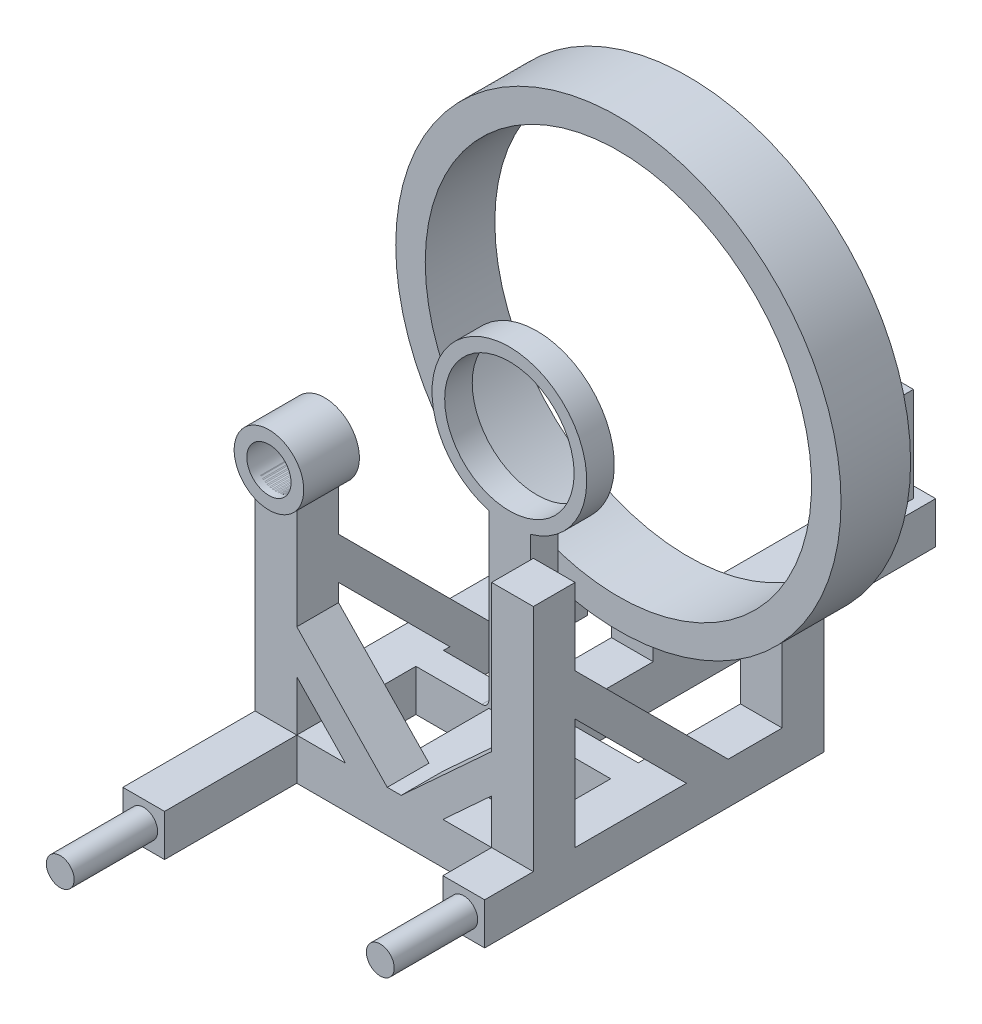
from build123d import *

# Parameters (mm, degrees)
SKETCH3_W            = 3
SKETCH3_H            = 3
SKETCH7_W            = 3
SKETCH7_H            = 3
BOSS_EXTRUDE1_DEPTH  = 16.5
SKETCH12_R           = 2.5
BOSS_EXTRUDE4_DEPTH  = 2
SKETCH17_R           = 1
BOSS_EXTRUDE5_DEPTH  = 6
SKETCH18_R           = 1
BOSS_EXTRUDE6_DEPTH  = 6
SKETCH19_W           = 3
SKETCH19_H           = 3
BOSS_EXTRUDE7_DEPTH  = 7.54
SKETCH21_W           = 3
SKETCH21_H           = 1.98
BOSS_EXTRUDE8_DEPTH  = 17.68
SKETCH22_R           = 5.56
BOSS_EXTRUDE9_DEPTH  = 0.99
SKETCH23_R           = 4.65
CUT_EXTRUDE2_DEPTH   = 2.5
SKETCH24_W           = 3
SKETCH24_H           = 3
BOSS_EXTRUDE10_DEPTH = 9.83
SKETCH25_W           = 3
SKETCH25_H           = 3
BOSS_EXTRUDE11_DEPTH = 3
SKETCH27_R           = 16
BOSS_EXTRUDE12_DEPTH = 2.5
SKETCH28_R           = 13.88
CUT_EXTRUDE3_DEPTH   = 7
SKETCH31_W           = 3
SKETCH31_H           = 3
BOSS_EXTRUDE13_DEPTH = 17.3
SKETCH32_W           = 1.4
SKETCH32_H           = 1.4
BOSS_EXTRUDE14_DEPTH = 6.8
SKETCH33_W           = 3
SKETCH33_H           = 3
BOSS_EXTRUDE15_DEPTH = 17.88
SKETCH34_W           = 3
SKETCH34_H           = 3
BOSS_EXTRUDE16_DEPTH = 5.5
SKETCH36_W           = 3
SKETCH36_H           = 3
SKETCH16_R           = 1.59
CUT_EXTRUDE7_DEPTH   = 5
SKETCH41_W           = 3
SKETCH41_H           = 3
BOSS_EXTRUDE17_DEPTH = 17.88
SKETCH42_W           = 3
SKETCH42_H           = 3
BOSS_EXTRUDE18_DEPTH = 5
SKETCH43_W           = 3
SKETCH43_H           = 3
BOSS_EXTRUDE19_DEPTH = 16.5
SKETCH47_W           = 3
SKETCH47_H           = 3
SKETCH53_W           = 3
SKETCH53_H           = 3
BOSS_EXTRUDE20_REACH = 63.391
SKETCH55_W           = 1.98
SKETCH55_H           = 3
BOSS_EXTRUDE21_REACH = 63.391
SKETCH56_W           = 1.98
SKETCH56_H           = 3
FILLET1_R            = 0.5
FILLET2_R            = 0.5


with BuildPart() as part:
    # Sweep3: sweep along a path in Sketch4
    with BuildLine(Plane(origin=(0, 0, 0), x_dir=(1, 0, 0), z_dir=(0, 1, 0))) as sweep3_path:
        Line((0, 0), (0, 11))
        Line((0, 11), (17, 11))
        Line((17, 11), (17, 6))
    # Sketch3 → Sweep3 (sweep)
    with BuildSketch(Plane.XY):
        Rectangle(SKETCH3_W, SKETCH3_H)
    sweep(path=sweep3_path.line, transition=Transition.RIGHT)

    # Sketch7 → Boss-Extrude1 (add)
    with BuildSketch(Plane(origin=(0, 0, 0), x_dir=(1, 0, 0), z_dir=(0, 1, 0))):
        with Locations((0, 11)):
            Rectangle(SKETCH7_W, SKETCH7_H)
    extrude(amount=BOSS_EXTRUDE1_DEPTH)

    # Sketch17 → Boss-Extrude5 (add)
    with BuildSketch(Plane.XY):
        Circle(SKETCH17_R)
    extrude(amount=BOSS_EXTRUDE5_DEPTH)

    # Sketch18 → Boss-Extrude6 (add)
    with BuildSketch(Plane.XY.offset(-6)):
        with Locations((17, 0)):
            Circle(SKETCH18_R)
    extrude(amount=BOSS_EXTRUDE6_DEPTH)

    # Sweep4: sweep along a path in Sketch39
    with BuildLine(Plane.XY.offset(-11)) as sweep4_path:
        Line((6.5, 1.5), (0, 8.24))
    # Sketch36 → Sweep4 (sweep)
    with BuildSketch(Plane(origin=(0, 1.5, 0), x_dir=(1, 0, 0), z_dir=(0, 1, 0))):
        with Locations((6.5, 11)):
            Rectangle(SKETCH36_W, SKETCH36_H)
    sweep(path=sweep4_path.line)


with BuildPart() as body_2:
    # Sketch12 → Boss-Extrude4 (new, symmetric)
    with BuildSketch(Plane.XY.offset(-11)):
        with Locations((0, 17.5)):
            Circle(SKETCH12_R)
    extrude(amount=BOSS_EXTRUDE4_DEPTH, both=True)


with BuildPart() as body_3:
    # Sketch19 → Boss-Extrude7 (new body)
    with BuildSketch(Plane.XY.offset(-12.5)):
        with Locations((8.24, 0)):
            Rectangle(SKETCH19_W, SKETCH19_H)
    extrude(amount=-BOSS_EXTRUDE7_DEPTH)

    # Sketch21 → Boss-Extrude8 (add)
    with BuildSketch(Plane(origin=(0, 1.5, 0), x_dir=(1, 0, 0), z_dir=(0, 1, 0))):
        with Locations((8.24, 19.05)):
            Rectangle(SKETCH21_W, SKETCH21_H)
    extrude(amount=BOSS_EXTRUDE8_DEPTH)

    # Sketch22 → Boss-Extrude9 (add, symmetric)
    with BuildSketch(Plane.XY.offset(-19.05)):
        with Locations((8.217064706, 19.179985124)):
            Circle(SKETCH22_R)
    extrude(amount=BOSS_EXTRUDE9_DEPTH, both=True)

    # Sketch23 → Cut-Extrude2 (cut, symmetric)
    with BuildSketch(Plane(origin=(0, 0, -20.04), x_dir=(-1, 0, 0), z_dir=(0, 0, -1))):
        with Locations((-8.217064706, 19.179985124)):
            Circle(SKETCH23_R)
    extrude(amount=CUT_EXTRUDE2_DEPTH, both=True, mode=Mode.SUBTRACT)

    # Sketch24 → Boss-Extrude10 (add)
    with BuildSketch(Plane(origin=(0, 0, -20.04), x_dir=(-1, 0, 0), z_dir=(0, 0, -1))):
        with Locations((-8.24, 0)):
            Rectangle(SKETCH24_W, SKETCH24_H)
    extrude(amount=BOSS_EXTRUDE10_DEPTH)

    # Sketch25 → Boss-Extrude11 (add)
    with BuildSketch(Plane(origin=(0, 1.5, 0), x_dir=(1, 0, 0), z_dir=(0, 1, 0))):
        with Locations((8.24, 28.37)):
            Rectangle(SKETCH25_W, SKETCH25_H)
    extrude(amount=BOSS_EXTRUDE11_DEPTH)

    # Sketch27 → Boss-Extrude12 (add, symmetric)
    with BuildSketch(Plane(origin=(0, 0, -28.37), x_dir=(-1, 0, 0), z_dir=(0, 0, -1))):
        with Locations((-8.24, 19.18)):
            Circle(SKETCH27_R)
    extrude(amount=BOSS_EXTRUDE12_DEPTH, both=True)

    # Sketch28 → Cut-Extrude3 (cut)
    with BuildSketch(Plane(origin=(0, 0, -30.87), x_dir=(-1, 0, 0), z_dir=(0, 0, -1))):
        with Locations((-8.24, 19.18)):
            Circle(SKETCH28_R)
    extrude(amount=-CUT_EXTRUDE3_DEPTH, mode=Mode.SUBTRACT)

    # Sketch31 → Boss-Extrude13 (add)
    with BuildSketch(Plane(origin=(0, 0, -29.87), x_dir=(-1, 0, 0), z_dir=(0, 0, -1))):
        with Locations((-8.24, 0)):
            Rectangle(SKETCH31_W, SKETCH31_H)
    extrude(amount=BOSS_EXTRUDE13_DEPTH)

    # Sketch32 → Boss-Extrude14 (add)
    with BuildSketch(Plane(origin=(0, 1.5, 0), x_dir=(1, 0, 0), z_dir=(0, 1, 0))):
        with Locations((8.24, 45.67)):
            Rectangle(SKETCH32_W, SKETCH32_H)
    extrude(amount=BOSS_EXTRUDE14_DEPTH)



with BuildPart() as body_4:
    # Sketch33 → Boss-Extrude15 (new body)
    with BuildSketch(Plane(origin=(0, 0, -12.5), x_dir=(-1, 0, 0), z_dir=(0, 0, -1))):
        with Locations((-17, 0)):
            Rectangle(SKETCH33_W, SKETCH33_H)
    extrude(amount=BOSS_EXTRUDE15_DEPTH)

    # Sketch34 → Boss-Extrude16 (add)
    with BuildSketch(Plane(origin=(0, 1.5, 0), x_dir=(1, 0, 0), z_dir=(0, 1, 0))):
        with Locations((17, 28.88)):
            Rectangle(SKETCH34_W, SKETCH34_H)
    extrude(amount=BOSS_EXTRUDE16_DEPTH)


with BuildPart() as cut_extrude7_tool:
    # Sketch16 → Cut-Extrude7 (new, symmetric)
    with BuildSketch(Plane(origin=(0, 0, -13), x_dir=(-1, 0, 0), z_dir=(0, 0, -1))):
        with Locations(Location((0, 17.5, 0), (0, 0, 180))):
            Circle(SKETCH16_R)
    extrude(amount=CUT_EXTRUDE7_DEPTH, both=True)


with BuildPart() as part_1:
    add(part.part)

    # Cut-Extrude7: cut by cut_extrude7_tool
    add(cut_extrude7_tool.part, mode=Mode.SUBTRACT)


with BuildPart() as body_2_1:
    add(body_2.part)

    # Cut-Extrude7: cut by cut_extrude7_tool
    add(cut_extrude7_tool.part, mode=Mode.SUBTRACT)


with BuildPart() as body_3_1:
    add(body_3.part)

    add(part_1.part)  # Boss-Extrude17 merges part
    # Sketch41 → Boss-Extrude17 (add)
    with BuildSketch(Plane(origin=(0, 0, -12.5), x_dir=(-1, 0, 0), z_dir=(0, 0, -1))):
        Rectangle(SKETCH41_W, SKETCH41_H)
    extrude(amount=BOSS_EXTRUDE17_DEPTH)

    # Sketch42 → Boss-Extrude18 (add)
    with BuildSketch(Plane(origin=(0, 1.5, 0), x_dir=(1, 0, 0), z_dir=(0, 1, 0))):
        with Locations((0, 28.88)):
            Rectangle(SKETCH42_W, SKETCH42_H)
    extrude(amount=BOSS_EXTRUDE18_DEPTH)


    add(body_4.part)  # Boss-Extrude19 merges body 4
    # Sketch43 → Boss-Extrude19 (add)
    with BuildSketch(Plane(origin=(0, 1.5, 0), x_dir=(1, 0, 0), z_dir=(0, 1, 0))):
        with Locations((17, 11)):
            Rectangle(SKETCH43_W, SKETCH43_H)
    extrude(amount=BOSS_EXTRUDE19_DEPTH)

    # Sweep5: sweep along a path in Sketch51
    with BuildLine(Plane.XY.offset(-11)) as sweep5_path:
        Line((10.5, 1.5), (17, 7.472026952))
    # Sketch47 → Sweep5 (sweep)
    with BuildSketch(Plane(origin=(0, 1.5, 0), x_dir=(1, 0, 0), z_dir=(0, 1, 0))):
        with Locations((10.5, 11)):
            Rectangle(SKETCH47_W, SKETCH47_H)
    sweep(path=sweep5_path.line)

    # Sweep6: sweep along a path in Sketch54
    with BuildLine(Plane.ZY.offset(1.5)) as sweep6_path:
        Line((-12.5, 11), (-23.5, 0))
    # Sketch53 → Sweep6 (sweep)
    with BuildSketch(Plane.XY.offset(-12.5)):
        with Locations((0, 11)):
            Rectangle(SKETCH53_W, SKETCH53_H)
    sweep6 = sweep(path=sweep6_path.line)

    # Mirror11: Sweep6 across plane
    add(sweep6.mirror(Plane.ZY.offset(-8.5)))

    # Sketch55 → Boss-Extrude20 (add, up to next)
    with BuildSketch(Plane.ZY.offset(-6.74), mode=Mode.PRIVATE) as boss_extrude20_sk1:
        with Locations((-19.05, 0)):
            Rectangle(SKETCH55_W, SKETCH55_H)
    boss_extrude20_tool1 = extrude(boss_extrude20_sk1.sketch, amount=BOSS_EXTRUDE20_REACH, mode=Mode.PRIVATE) - body_3_1.part
    add(boss_extrude20_tool1.solids().sort_by_distance((6.74, 0, -19.05))[0])

    # Sketch56 → Boss-Extrude21 (add, up to next)
    with BuildSketch(Plane(origin=(9.74, 0, 0), x_dir=(0, 0, -1), z_dir=(1, 0, 0)), mode=Mode.PRIVATE) as boss_extrude21_sk1:
        with Locations((19.05, 0)):
            Rectangle(SKETCH56_W, SKETCH56_H)
    boss_extrude21_tool1 = extrude(boss_extrude21_sk1.sketch, amount=BOSS_EXTRUDE21_REACH, mode=Mode.PRIVATE) - body_3_1.part
    add(boss_extrude21_tool1.solids().sort_by_distance((9.74, 0, -19.05))[0])

    # Fillet1
    # the kernel refuses this fillet: 0.5 mm, written as the material it adds along each edge
    with BuildSketch(Plane(origin=(6.74, 1.5, -20.04), x_dir=(-1, 0, 0), z_dir=(0, 0, 1))) as fillet1_piece_1:
        with BuildLine():
            CenterArc((FILLET1_R, -FILLET1_R), FILLET1_R, 90, 90)
            Line((0, -FILLET1_R), (0, 0))
            Line((0, 0), (FILLET1_R, 0))
        make_face()
    extrude(amount=1.98)

    # Fillet2
    # the kernel refuses this fillet: 0.5 mm, written as the material it adds along each edge
    with BuildSketch(Plane(origin=(9.74, 1.5, -18.06), x_dir=(0, 1, 0), z_dir=(0, 0, -1))) as fillet2_piece_1:
        with BuildLine():
            CenterArc((FILLET2_R, FILLET2_R), FILLET2_R, 180, 90)
            Line((0, FILLET2_R), (0, 0))
            Line((0, 0), (FILLET2_R, 0))
        make_face()
    extrude(amount=1.98)


solid = Compound([body_2_1.part, body_3_1.part])
